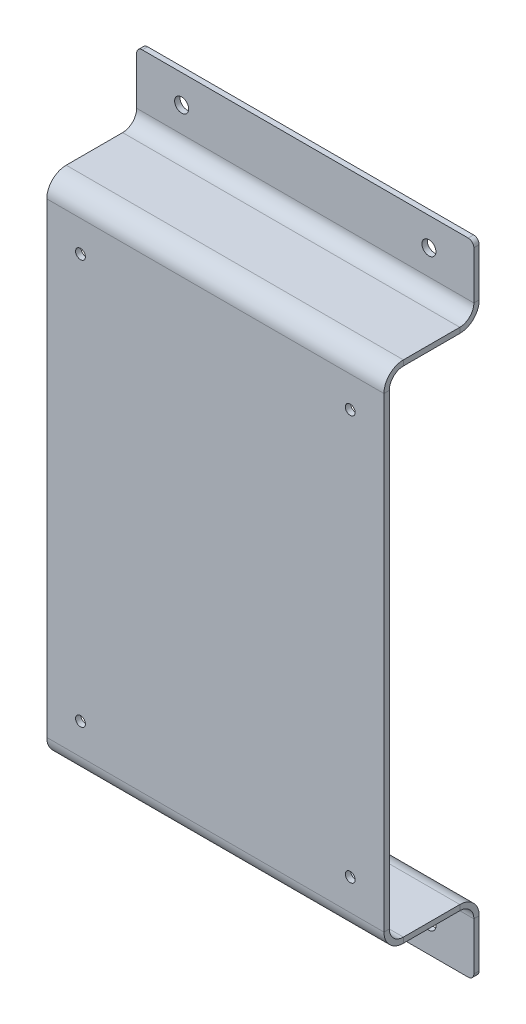
from build123d import *

# Parameters (mm, degrees)
BASE_FLANGE1_DEPTH           = 190.5
SKETCH3_R                    = 2.778125
CUT_EXTRUDE1_DEPTH           = 3.03784
EDGE_FLANGE1_STRIP_W         = 28.02636
EDGE_FLANGE1_STRIP_H         = 3.03784
EDGE_FLANGE1_STRIP_CUT_DEPTH = 190.5
EDGE_FLANGE1_DEPTH           = 190.5
EDGE_FLANGE2_STRIP_W         = 28.02636
EDGE_FLANGE2_STRIP_H         = 3.03784
EDGE_FLANGE2_STRIP_CUT_DEPTH = 190.5
EDGE_FLANGE2_DEPTH           = 190.5
FILLET1_R                    = 3.175
SKETCH12_R                   = 3.96875
CUT_EXTRUDE2_DEPTH           = 3.03784


# Sheet-metal steps are written as plain solids
with BuildPart() as part:
    # Sketch1 → Base-Flange1 (new body)
    with BuildSketch(Plane(origin=(0, 0, 0), x_dir=(0, 0, -1), z_dir=(1, 0, 0))):
        with BuildLine():
            Line((50.8, 279.4), (7.9375, 279.4))
            ThreePointArc((7.9375, 279.4), (2.324839924, 277.075160076), (0, 271.4625))
            Line((0, 271.4625), (0, 7.9375))
            ThreePointArc((0, 7.9375), (2.324839924, 2.324839924), (7.9375, 0))
            Line((7.9375, 0), (50.8, 0))
            Line((50.8, 0), (50.8, -3.03784))
            Line((50.8, -3.03784), (7.9375, -3.03784))
            ThreePointArc((7.9375, -3.03784), (0.17676266, 0.17676266), (-3.03784, 7.9375))
            Line((-3.03784, 7.9375), (-3.03784, 271.4625))
            ThreePointArc((-3.03784, 271.4625), (0.17676266, 279.22323734), (7.9375, 282.43784))
            Line((7.9375, 282.43784), (50.8, 282.43784))
            Line((50.8, 282.43784), (50.8, 279.4))
        make_face()
    extrude(amount=BASE_FLANGE1_DEPTH)

    # Sketch3 → Cut-Extrude1 (cut)
    with BuildSketch(Plane.XY.offset(3.03784)):
        with Locations((171.45, 254)):
            Circle(SKETCH3_R)
        with Locations((19.05, 254)):
            Circle(SKETCH3_R)
        with Locations((171.45, 25.4)):
            Circle(SKETCH3_R)
        with Locations((19.05, 25.4)):
            Circle(SKETCH3_R)
    extrude(amount=-CUT_EXTRUDE1_DEPTH, mode=Mode.SUBTRACT)

    # Edge-Flange1 strip (across the edge) → Edge-Flange1 strip cut (cut)
    with BuildSketch(Plane(origin=(0, -3.03784, -50.8), x_dir=(0, 0, 1), z_dir=(1, 0, 0))):
        with Locations((-3.03784, -1.51892)):
            Rectangle(EDGE_FLANGE1_STRIP_W, EDGE_FLANGE1_STRIP_H)
    extrude(amount=EDGE_FLANGE1_STRIP_CUT_DEPTH, mode=Mode.SUBTRACT)

    # Edge-Flange1 section (across the edge) → Edge-Flange1 (add)
    with BuildSketch(Plane(origin=(0, -3.03784, -50.8), x_dir=(0, 0, 1), z_dir=(1, 0, 0))):
        with BuildLine():
            Line((0, 7.9375), (0, 38.1))
            Line((0, 38.1), (3.03784, 38.1))
            Line((3.03784, 38.1), (3.03784, 7.9375))
            ThreePointArc((3.03784, 7.9375), (5.362679924, 2.324839924), (10.97534, 0))
            Line((10.97534, 0), (10.97534, -3.03784))
            ThreePointArc((10.97534, -3.03784), (3.21460266, 0.17676266), (0, 7.9375))
        make_face()
    extrude(amount=EDGE_FLANGE1_DEPTH)

    # Edge-Flange2 strip (across the edge) → Edge-Flange2 strip cut (cut)
    with BuildSketch(Plane(origin=(190.5, 282.43784, -50.8), x_dir=(0, 0, 1), z_dir=(-1, 0, 0))):
        with Locations((-3.03784, -1.51892)):
            Rectangle(EDGE_FLANGE2_STRIP_W, EDGE_FLANGE2_STRIP_H)
    extrude(amount=EDGE_FLANGE2_STRIP_CUT_DEPTH, mode=Mode.SUBTRACT)

    # Edge-Flange2 section (across the edge) → Edge-Flange2 (add)
    with BuildSketch(Plane(origin=(190.5, 282.43784, -50.8), x_dir=(0, 0, 1), z_dir=(-1, 0, 0))):
        with BuildLine():
            Line((0, 7.9375), (0, 38.1))
            Line((0, 38.1), (3.03784, 38.1))
            Line((3.03784, 38.1), (3.03784, 7.9375))
            ThreePointArc((3.03784, 7.9375), (5.362679924, 2.324839924), (10.97534, 0))
            Line((10.97534, 0), (10.97534, -3.03784))
            ThreePointArc((10.97534, -3.03784), (3.21460266, 0.17676266), (0, 7.9375))
        make_face()
    extrude(amount=EDGE_FLANGE2_DEPTH)

    # Fillet1
    fillet1_edges = [part.edges().sort_by_distance(p)[0] for p in [
        (190.5, 320.53784, -49.28108),
        (0, 320.53784, -49.28108),
        (0, -41.13784, -49.28108),
        (190.5, -41.13784, -49.28108),
    ]]
    fillet(fillet1_edges, radius=FILLET1_R)

    # Sketch12 → Cut-Extrude2 (cut)
    with BuildSketch(Plane.XY.offset(-47.76216)):
        with Locations((25.4, 304.66284)):
            Circle(SKETCH12_R)
        with Locations((165.1, 304.66284)):
            Circle(SKETCH12_R)
        with Locations((165.1, -25.26284)):
            Circle(SKETCH12_R)
        with Locations((25.4, -25.26284)):
            Circle(SKETCH12_R)
    extrude(amount=-CUT_EXTRUDE2_DEPTH, mode=Mode.SUBTRACT)


solid = part.part
